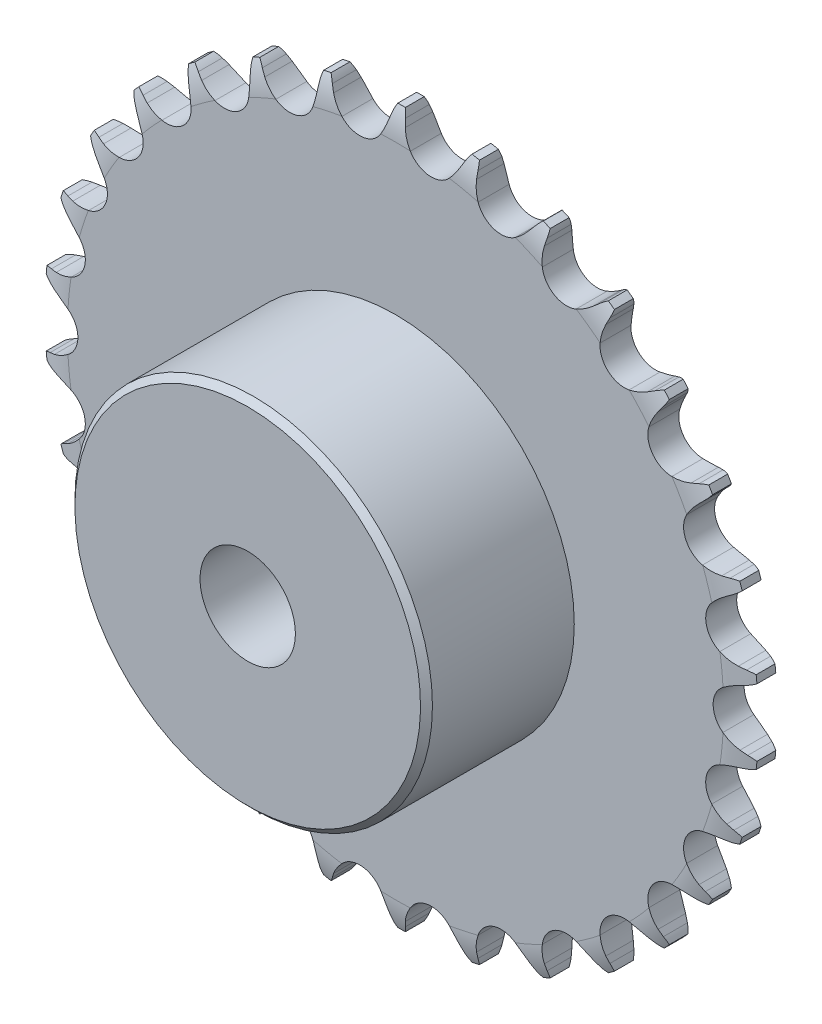
from build123d import *

# Parameters (mm, degrees)
CUT_EXTRUDE1_DEPTH      = 43.93130128
CIRPATTERN1_COUNT       = 30
BOSS_EXTRUDE1_START     = 1.3
SKETCH2_R               = 15
BOSS_EXTRUDE1_DEPTH     = 12.4
CUT_EXTRUDE2_DEPTH      = 45.940072418
CUT_EXTRUDE2_DEPTH_BACK = 45.940072418
SKETCH3_R               = 4
SKETCH4_W               = 1.95
SKETCH4_H               = 5.742776662
CUT_EXTRUDE3_DEPTH      = 45.940072418
CUT_EXTRUDE3_DEPTH_BACK = 45.940072418
SKETCH5_OUTSIDE_W       = 79.754
SKETCH5_OUTSIDE_H       = 80.068
SKETCH5_OUTSIDE_R       = 29.95


with BuildPart() as part:
    # Sketch1 → Revolve1 (revolve)
    with BuildSketch(Plane(origin=(0, 0, 0), x_dir=(0, 0, -1), z_dir=(1, 0, 0))):
        with BuildLine():
            Line((1.3, 0), (-1.3, 0))
            Line((-1.3, 0), (-1.3, 27.530621141))
            ThreePointArc((-1.3, 27.530621141), (-1.122370651, 28.979758815), (-0.6, 30.343093363))
            Line((-0.6, 30.343093363), (0.6, 30.343093363))
            ThreePointArc((0.6, 30.343093363), (1.122370651, 28.979758815), (1.3, 27.530621141))
            Line((1.3, 27.530621141), (1.3, 0))
        make_face()
    revolve(axis=Axis((0, 0, -1.3), (0, 0, 1)))

    # Sketch0 → Cut-Extrude1 (cut, symmetric)
    with BuildSketch(Plane.XY):
        with BuildLine():
            Line((5.58876027, -28.842280787), (5.341291361, -28.353788773))
            ThreePointArc((5.341291361, -28.353788773), (4.962159599, -27.72030576), (4.497885516, -27.146292521))
            ThreePointArc((4.497885516, -27.146292521), (2.785915254, -26.506213069), (1.244435651, -27.488243881))
            ThreePointArc((1.244435651, -27.488243881), (0.909651135, -28.146241563), (0.670512835, -28.844707378))
            Line((0.670512835, -28.844707378), (0.530014917, -29.373976348))
            ThreePointArc((0.530014917, -29.373976348), (-0.744172098, -31.197007964), (-2.893772448, -31.768160441))
            ThreePointArc((-2.893772448, -31.768160441), (3.334425107, -31.724935713), (9.435508528, -30.472300793))
            ThreePointArc((9.435508528, -30.472300793), (7.214132826, -30.360556411), (5.58876027, -28.842280787))
        make_face()
    cut_extrude1 = extrude(amount=CUT_EXTRUDE1_DEPTH, both=True, mode=Mode.SUBTRACT)

    # CirPattern1: Cut-Extrude1 ×30 about axis
    cirpattern1_axis = Axis((0, 0, 0), (0, 0, 1))
    for i in range(1, CIRPATTERN1_COUNT):
        add(cut_extrude1.rotate(cirpattern1_axis, i * 360 / CIRPATTERN1_COUNT), mode=Mode.SUBTRACT)

    # Sketch2 → Boss-Extrude1 (add)
    with BuildSketch(Plane.XY.offset(BOSS_EXTRUDE1_START)):
        with Locations(Location((0, 0, 0), (0, 0, 270))):
            Circle(SKETCH2_R)
    extrude(amount=BOSS_EXTRUDE1_DEPTH)

    # Sketch3 → Cut-Extrude2 (cut, two sides: drawn at the far end of the back side and taken through both)
    with BuildSketch(Plane.XY.offset(-CUT_EXTRUDE2_DEPTH_BACK)):
        Circle(SKETCH3_R)
    extrude(amount=CUT_EXTRUDE2_DEPTH + CUT_EXTRUDE2_DEPTH_BACK, mode=Mode.SUBTRACT)

    # Sketch4 → Cut-Revolve1 (revolve, cut)
    with BuildSketch(Plane(origin=(0, 0, 0), x_dir=(0, 0, -1), z_dir=(1, 0, 0))):
        Polygon((-13.7, 15), (-13.7, 14.5), (-13.2, 15), align=None)
        with Locations((-2.275, 27.471705032)):
            Rectangle(SKETCH4_W, SKETCH4_H)
    revolve(axis=Axis((0, 0, -1.3), (0, 0, 1)), mode=Mode.SUBTRACT)

    # Sketch5 outside → Cut-Extrude3 (cut, two sides: drawn at the far end of the back side and taken through both)
    with BuildSketch(Plane.XY.offset(-CUT_EXTRUDE3_DEPTH_BACK)):
        Rectangle(SKETCH5_OUTSIDE_W, SKETCH5_OUTSIDE_H)
        Circle(SKETCH5_OUTSIDE_R, mode=Mode.SUBTRACT)
    extrude(amount=CUT_EXTRUDE3_DEPTH + CUT_EXTRUDE3_DEPTH_BACK, mode=Mode.SUBTRACT)


solid = part.part
